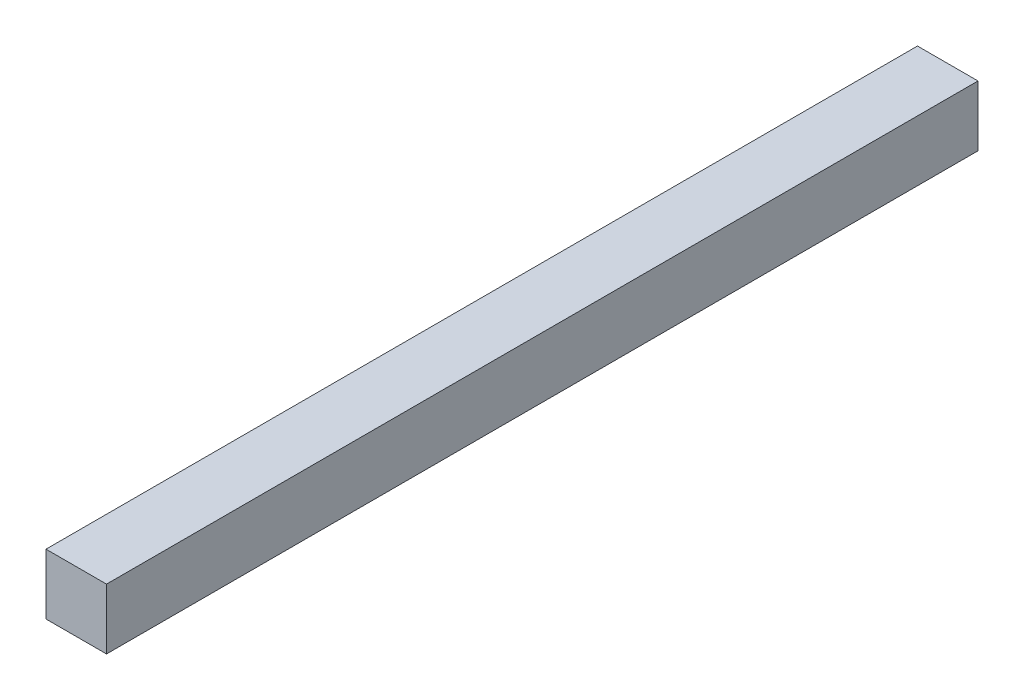
from build123d import *

# Parameters (mm, degrees)
SKETCH1_W           = 50
SKETCH1_H           = 50
BOSS_EXTRUDE1_DEPTH = 720


with BuildPart() as part:
    # Sketch1 → Boss-Extrude1 (new body)
    with BuildSketch(Plane.XY):
        Rectangle(SKETCH1_W, SKETCH1_H)
    extrude(amount=BOSS_EXTRUDE1_DEPTH)


solid = part.part
